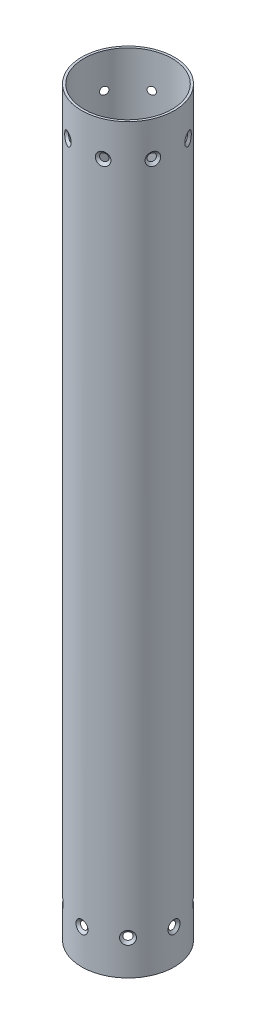
from build123d import *

# Parameters (mm, degrees)
SKETCH1_R                 = 25.4
SKETCH1_R_2               = 24.1554
BODY_DEPTH                = 406.4
BOTTOM_BOLT_PATTERN_COUNT = 8
TOP_BOLT_PATTERN_COUNT    = 8


with BuildPart() as part:
    # Sketch1 → body (new body)
    with BuildSketch(Plane(origin=(0, 0, 0), x_dir=(1, 0, 0), z_dir=(0, 1, 0))):
        Circle(SKETCH1_R)
        Circle(SKETCH1_R_2, mode=Mode.SUBTRACT)
    extrude(amount=BODY_DEPTH)

    # Sketch2 → CSK for _6 Flat Head Machine Screw _100 (revolve, cut)
    with BuildSketch(Plane(origin=(25.4, 19.05, 0), x_dir=(-6e-17, 0, -1), z_dir=(0, 1, 0))):
        Polygon((0, 0), (-1.06e-15, 4.315824014316676), (1.898649999999998, 3.174999999999999), (1.898649999999998, 1.3800252084157134), (3.5432999999999995, -1.73e-15), align=None)
    csk_for_6_flat_head_machine_screw_100 = revolve(axis=Axis((31.74999999999999, 19.05, -3.9e-16), (-1, 0, 6e-17)), mode=Mode.SUBTRACT)

    # bottom-bolt-pattern: CSK for _6 Flat Head Machine Screw _100 ×8 about axis
    bottom_bolt_pattern_axis = Axis((0, 406.4, 0), (0, -1, 0))
    for i in range(1, BOTTOM_BOLT_PATTERN_COUNT):
        add(csk_for_6_flat_head_machine_screw_100.rotate(bottom_bolt_pattern_axis, i * 360 / BOTTOM_BOLT_PATTERN_COUNT), mode=Mode.SUBTRACT)

    # Sketch4 → CSK for _6 Flat Head Machine Screw _ 2 (revolve, cut)
    with BuildSketch(Plane(origin=(9.720159182073301, 387.34999999999997, -23.466540125786675), x_dir=(-0.9238795325112865, 0, -0.3826834323650906), z_dir=(0, 1, 0))):
        Polygon((0, 0), (-1.06e-15, 4.315824014316677), (1.898649999999998, 3.174999999999999), (1.8986499999999895, 1.3800252084157083), (3.5432999999999995, -1.73e-15), align=None)
    csk_for_6_flat_head_machine_screw_2 = revolve(axis=Axis((12.150198977591623, 387.34999999999997, -29.333175157233335), (-0.38268343236509056, 0, 0.9238795325112865)), mode=Mode.SUBTRACT)

    # top-bolt-pattern: CSK for _6 Flat Head Machine Screw _ 2 ×8 about axis
    top_bolt_pattern_axis = Axis((0, 406.4, 0), (0, -1, 0))
    for i in range(1, TOP_BOLT_PATTERN_COUNT):
        add(csk_for_6_flat_head_machine_screw_2.rotate(top_bolt_pattern_axis, i * 360 / TOP_BOLT_PATTERN_COUNT), mode=Mode.SUBTRACT)


solid = part.part
